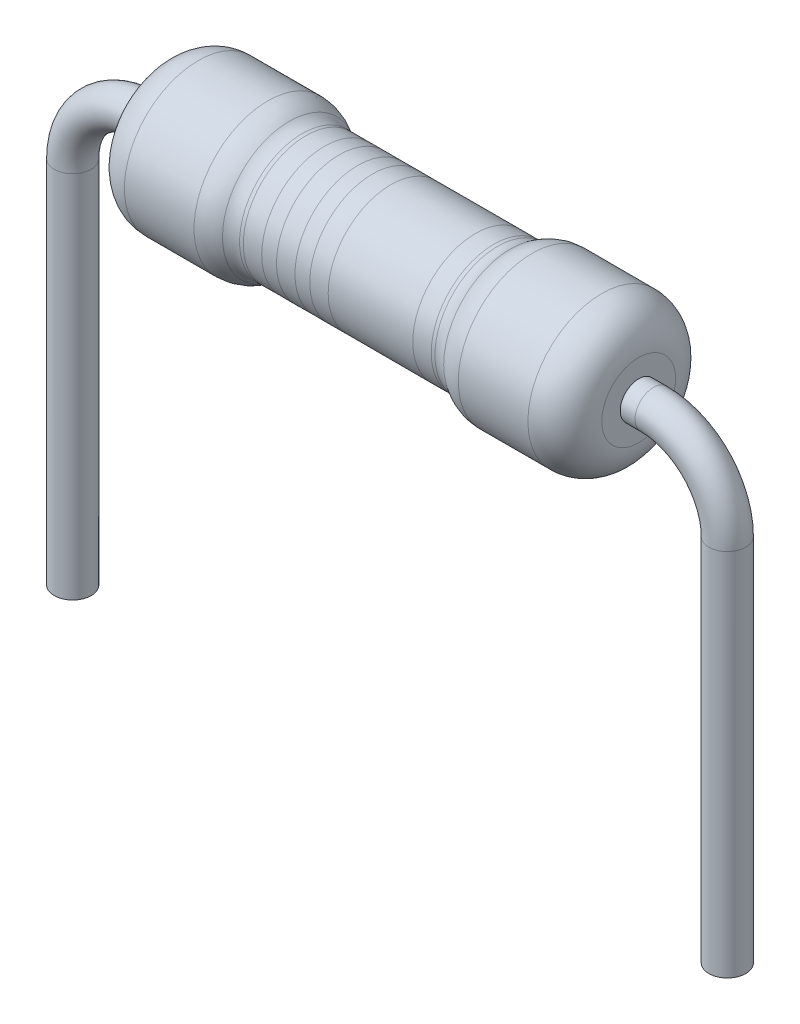
from build123d import *

# Parameters (mm, degrees)
SKETCH58_R          = 1
BOSS_EXTRUDE1_DEPTH = 6.464
SKETCH59_W          = 2.864
SKETCH59_H          = 0.3
FILLET6_R           = 0.5
FILLET7_R           = 0.3
SKETCH54_R          = 0.25


with BuildPart() as part:
    # Sketch58 → Boss-Extrude1 (new body)
    with BuildSketch(Plane(origin=(0, 0, 0), x_dir=(0, 0, -1), z_dir=(1, 0, 0))):
        Circle(SKETCH58_R)
    extrude(amount=BOSS_EXTRUDE1_DEPTH)

    # Sketch59 → Cut-Revolve1 (revolve, cut)
    with BuildSketch(Plane.XY, mode=Mode.PRIVATE) as cut_revolve1_sk:
        with Locations((3.232, 1)):
            Rectangle(SKETCH59_W, SKETCH59_H)
    revolve(cut_revolve1_sk.sketch.rotate(Axis((6.464, 0, 0), (-1, 0, 0)), 90), axis=Axis((6.464, 0, 0), (-1, 0, 0)), mode=Mode.SUBTRACT)

    # Fillet6
    # the kernel refuses this fillet: 0.5 mm, written as the material it takes off along each edge
    with BuildSketch(Plane(origin=(0, 0, 0), x_dir=(0, 0, -1), z_dir=(0, -1, 0))) as fillet6_piece_1:
        with BuildLine():
            CenterArc((1 - FILLET6_R, FILLET6_R), FILLET6_R, 270, 90)
            Line((1 - FILLET6_R, 0), (1 - FILLET6_R, -FILLET6_R * 0.02))
            Line((1 - FILLET6_R, -FILLET6_R * 0.02), (1 + FILLET6_R * 0.02, -FILLET6_R * 0.02))
            Line((1 + FILLET6_R * 0.02, -FILLET6_R * 0.02), (1 + FILLET6_R * 0.02, FILLET6_R))
            Line((1 + FILLET6_R * 0.02, FILLET6_R), (1, FILLET6_R))
        make_face()
    revolve(axis=Axis((0, 0, 0), (1, 0, 0)), mode=Mode.SUBTRACT)
    with BuildSketch(Plane(origin=(6.464, 0, 0), x_dir=(0, 0, -1), z_dir=(0, -1, 0))) as fillet6_piece_2:
        with BuildLine():
            CenterArc((1 - FILLET6_R, -FILLET6_R), FILLET6_R, 0, 90)
            Line((1 - FILLET6_R, 0), (1 - FILLET6_R, FILLET6_R * 0.02))
            Line((1 - FILLET6_R, FILLET6_R * 0.02), (1 + FILLET6_R * 0.02, FILLET6_R * 0.02))
            Line((1 + FILLET6_R * 0.02, FILLET6_R * 0.02), (1 + FILLET6_R * 0.02, -FILLET6_R))
            Line((1 + FILLET6_R * 0.02, -FILLET6_R), (1, -FILLET6_R))
        make_face()
    revolve(axis=Axis((6.464, 0, 0), (1, 0, 0)), mode=Mode.SUBTRACT)
    with BuildSketch(Plane(origin=(1.8, 0, 0), x_dir=(0, 0, -1), z_dir=(0, 1, 0))) as fillet6_piece_3:
        with BuildLine():
            CenterArc((0.5, 0.357071421), FILLET6_R, 314.427004001, 45.572995999)
            Line((0.85, 0), (0.857, -0.007141428))
            ThreePointArc((0.857, -0.007141428), (0.925, -0.01), (1, -0.01))
            Line((1, -0.01), (1.01, 0))
            Line((1.01, 0), (1.01, 0.357071421))
            Line((1.01, 0.357071421), (1, 0.357071421))
        make_face()
    revolve(axis=Axis((1.8, 0, 0), (-1, 0, 0)), mode=Mode.SUBTRACT)
    with BuildSketch(Plane(origin=(4.664, 0, 0), x_dir=(0, 0, -1), z_dir=(0, 1, 0))) as fillet6_piece_4:
        with BuildLine():
            CenterArc((0.5, -0.357071421), FILLET6_R, 0, 45.572995999)
            Line((1, -0.357071421), (1.01, -0.357071421))
            Line((1.01, -0.357071421), (1.01, 0))
            Line((1.01, 0), (1, 0.01))
            ThreePointArc((1, 0.01), (0.925, 0.01), (0.857, 0.007141428))
            Line((0.857, 0.007141428), (0.85, 0))
        make_face()
    revolve(axis=Axis((4.664, 0, 0), (-1, 0, 0)), mode=Mode.SUBTRACT)

    # Fillet7
    fillet7_edges = [part.edges().sort_by_distance(p)[0] for p in [
        (1.8, 0, 0.85),
        (4.664, 0, 0.85),
    ]]
    fillet(fillet7_edges, radius=FILLET7_R)

    # Sweep1: sweep along a path in Sketch55
    with BuildLine(Plane.XY) as sweep1_path:
        Line((0, 0), (-0.2, 0))
        ThreePointArc((-0.2, 0), (-0.907106781, -0.292893219), (-1.2, -1))
        Line((-1.2, -1), (-1.2, -6))
    # Sketch54 → Sweep1 (sweep)
    with BuildSketch(Plane(origin=(0, 0, 0), x_dir=(0, 0, -1), z_dir=(1, 0, 0))):
        Circle(SKETCH54_R)
    sweep1 = sweep(path=sweep1_path.line)

    # Mirror1: Sweep1 across plane
    add(sweep1.mirror(Plane(origin=(3.232, 0, 0), x_dir=(0, 0, 1), z_dir=(1, 0, 0))))


solid = part.part
